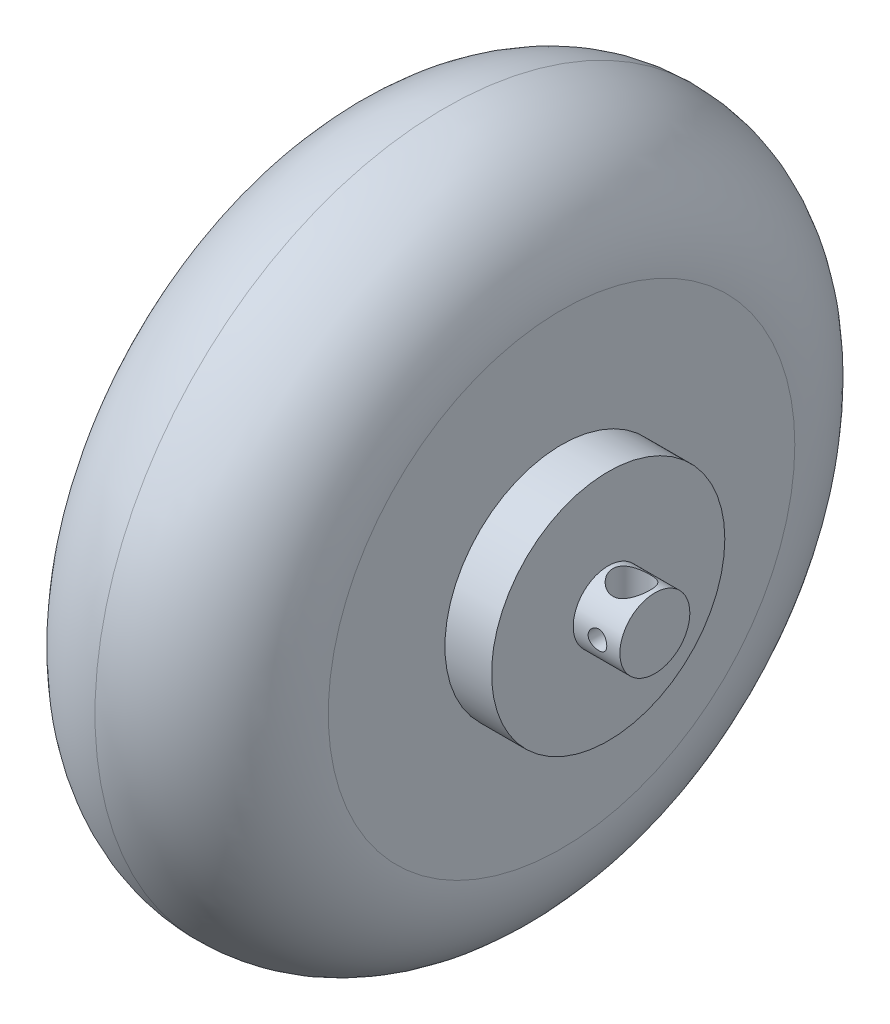
from build123d import *

# Parameters (mm, degrees)
IZIM1_R                          = 75
IZIM1_R_2                        = 25
Y_KSEKLIK_EKSTR_ZYON2_DEPTH      = 50
RADYUS2_R                        = 25
Y_KSEKLIK_EKSTR_ZYON3_DEPTH      = 60
Y_KSEKLIK_EKSTR_ZYON3_DEPTH_BACK = 10
IZIM2_R                          = 25
IZIM3_R                          = 7.5
Y_KSEKLIK_EKSTR_ZYON5_DEPTH      = 10
KES_EKSTR_ZYON1_DEPTH            = 10
KES_EKSTR_ZYON1_DEPTH_BACK       = 10
IZIM4_R                          = 4
Y_KSEKLIK_EKSTR_ZYON6_START      = 10
IZIM5_R                          = 7.5
Y_KSEKLIK_EKSTR_ZYON6_DEPTH      = 10
KES_EKSTR_ZYON2_DEPTH            = 10
KES_EKSTR_ZYON2_DEPTH_BACK       = 10
IZIM6_R                          = 4
KES_EKSTR_ZYON3_DEPTH            = 10
KES_EKSTR_ZYON3_DEPTH_BACK       = 10
IZIM7_R                          = 2
KES_EKSTR_ZYON4_DEPTH            = 10
KES_EKSTR_ZYON4_DEPTH_BACK       = 10
IZIM8_R                          = 2
L_EK2_SCALE                      = 0.5


with BuildPart() as part:
    # Çizim1 → Yükseklik-Ekstrüzyon2 (new body)
    with BuildSketch(Plane(origin=(0, 0, 0), x_dir=(0, 0, -1), z_dir=(1, 0, 0))):
        Circle(IZIM1_R)
        Circle(IZIM1_R_2, mode=Mode.SUBTRACT)
    extrude(amount=Y_KSEKLIK_EKSTR_ZYON2_DEPTH)

    # Radyus2
    radyus2_edges = [part.edges().sort_by_distance(p)[0] for p in [
        (0, 0, 75),
        (50, 0, 75),
    ]]
    fillet(radyus2_edges, radius=RADYUS2_R - 0.0001)  # a hair under: the kernel refuses the full size

    # Çizim2 → Yükseklik-Ekstrüzyon3 (add, two sides: drawn at the far end of the back side and taken through both)
    with BuildSketch(Plane(origin=(0, 0, 0), x_dir=(0, 0, -1), z_dir=(1, 0, 0)).offset(-Y_KSEKLIK_EKSTR_ZYON3_DEPTH_BACK)):
        Circle(IZIM2_R)
    extrude(amount=Y_KSEKLIK_EKSTR_ZYON3_DEPTH + Y_KSEKLIK_EKSTR_ZYON3_DEPTH_BACK)

    # Çizim3 → Yükseklik-Ekstrüzyon5 (add)
    with BuildSketch(Plane(origin=(60, 0, 0), x_dir=(0, 0, -1), z_dir=(1, 0, 0))):
        Circle(IZIM3_R)
    extrude(amount=Y_KSEKLIK_EKSTR_ZYON5_DEPTH)

    # Çizim4 → Kes-Ekstrüzyon1 (cut, two sides: drawn at the far end of the back side and taken through both)
    with BuildSketch(Plane(origin=(0, 0, 0), x_dir=(1, 0, 0), z_dir=(0, 1, 0)).offset(-KES_EKSTR_ZYON1_DEPTH_BACK)):
        with Locations(Location((65, 0, 0), (0, 0, 90))):
            Circle(IZIM4_R)
    extrude(amount=KES_EKSTR_ZYON1_DEPTH + KES_EKSTR_ZYON1_DEPTH_BACK, mode=Mode.SUBTRACT)

    # Çizim5 → Yükseklik-Ekstrüzyon6 (add)
    with BuildSketch(Plane.ZY.offset(10).offset(Y_KSEKLIK_EKSTR_ZYON6_START)):
        with Locations(Location((0, 0, 0), (0, 0, 180))):
            Circle(IZIM5_R)
    extrude(amount=-Y_KSEKLIK_EKSTR_ZYON6_DEPTH)

    # Çizim6 → Kes-Ekstrüzyon2 (cut, two sides: drawn at the far end of the back side and taken through both)
    with BuildSketch(Plane(origin=(0, 0, 0), x_dir=(1, 0, 0), z_dir=(0, 1, 0)).offset(-KES_EKSTR_ZYON2_DEPTH_BACK)):
        with Locations(Location((-15, 0, 0), (0, 0, 90))):
            Circle(IZIM6_R)
    extrude(amount=KES_EKSTR_ZYON2_DEPTH + KES_EKSTR_ZYON2_DEPTH_BACK, mode=Mode.SUBTRACT)

    # Çizim7 → Kes-Ekstrüzyon3 (cut, two sides: drawn at the far end of the back side and taken through both)
    with BuildSketch(Plane.XY.offset(-KES_EKSTR_ZYON3_DEPTH_BACK)):
        with Locations(Location((65.194673775, 0, 0), (0, 0, 180))):
            Circle(IZIM7_R)
    extrude(amount=KES_EKSTR_ZYON3_DEPTH + KES_EKSTR_ZYON3_DEPTH_BACK, mode=Mode.SUBTRACT)

    # Çizim8 → Kes-Ekstrüzyon4 (cut, two sides: drawn at the far end of the back side and taken through both)
    with BuildSketch(Plane.XY.offset(-KES_EKSTR_ZYON4_DEPTH_BACK)):
        with Locations(Location((-15.164276084, 0, 0), (0, 0, 180))):
            Circle(IZIM8_R)
    extrude(amount=KES_EKSTR_ZYON4_DEPTH + KES_EKSTR_ZYON4_DEPTH_BACK, mode=Mode.SUBTRACT)


with BuildPart() as part_1:
    # Ölçek2: scaled about (24.999995203, 7e-09, 5.8e-08)
    add(part.part.scale(L_EK2_SCALE).moved(Location((12.499997602, 3e-09, 2.9e-08))))


solid = part_1.part
